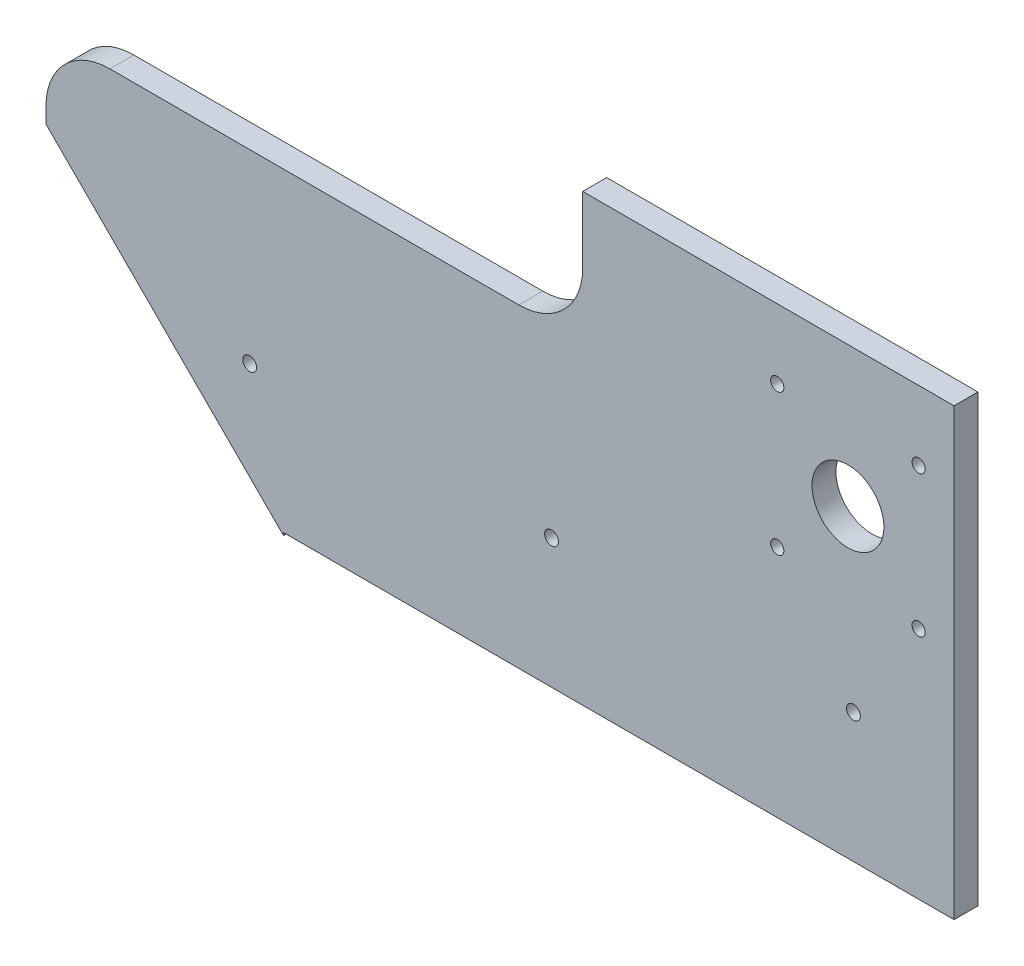
from build123d import *

# Parameters (mm, degrees)
SKETCH1_R                    = 14.2875
BOSS_EXTRUDE1_DEPTH          = 9.525
SKETCH2_W                    = 285.57287806
SKETCH2_H                    = 77.089
CUT_EXTRUDE1_DEPTH           = 267.58430025
SKETCH4_W                    = 213.36
SKETCH4_H                    = 65.465352004
CUT_EXTRUDE2_DEPTH           = 267.58430025
FILLET2_R                    = 25.4
F_5_5_5_5_DIAMETER_HOLE1_D   = 5.5
SKETCH16_W                   = 9.525
SKETCH16_H                   = 0.985363282
CUT_EXTRUDE3_DEPTH           = 390.572219806
SKETCH17_W                   = 147.610011278
SKETCH17_H                   = 12.7
CUT_EXTRUDE4_DEPTH           = 267.045158533
TAP_DRILL_FOR_M6X0_75_TAP1_D = 5.25


with BuildPart() as part:
    # Sketch1 → Boss-Extrude1 (new body)
    with BuildSketch(Plane.XY):
        Polygon((-138.259383474, 48.991487021), (32.210627804, -121.478524257), (222.710627804, -121.478524257), (222.710627804, 146.206839025), (-138.259383474, 146.206839025), align=None)
        with Locations((180.538014078, 76.831975743)):
            Circle(SKETCH1_R, mode=Mode.SUBTRACT)
    extrude(amount=BOSS_EXTRUDE1_DEPTH)

    # Sketch2 → Cut-Extrude1 (cut, through all)
    with BuildSketch(Plane.XY.offset(9.525)):
        with Locations((98.974188774, -82.934024257)):
            Rectangle(SKETCH2_W, SKETCH2_H)
    extrude(amount=-CUT_EXTRUDE1_DEPTH, mode=Mode.SUBTRACT)

    # Sketch4 → Cut-Extrude2 (cut, through all)
    with BuildSketch(Plane.XY.offset(9.525)):
        with Locations((-31.579383474, 113.474163023)):
            Rectangle(SKETCH4_W, SKETCH4_H)
    extrude(amount=-CUT_EXTRUDE2_DEPTH, mode=Mode.SUBTRACT)

    # Fillet2
    fillet2_edges = [part.edges().sort_by_distance(p)[0] for p in [
        (-138.259383474, 80.741487021, 4.7625),
        (75.100616526, 80.741487021, 4.7625),
    ]]
    fillet(fillet2_edges, radius=FILLET2_R)

    # Ø5.5 (5.5) Diameter Hole1 (through all)
    with Locations(Plane(origin=(0, 0, 0), x_dir=(-1, 0, 0), z_dir=(0, 0, -1))):
        with Locations((-182.710627794, 7.042935743), (-62.710627794, 7.042935743), (57.289372206, 7.042935743)):
            Hole(F_5_5_5_5_DIAMETER_HOLE1_D / 2)

    # Sketch16 → Cut-Extrude3 (cut, through all)
    with BuildSketch(Plane(origin=(222.710627804, 0, 0), x_dir=(0, 0, -1), z_dir=(1, 0, 0))):
        with Locations((-4.7625, 145.714157384)):
            Rectangle(SKETCH16_W, SKETCH16_H)
    extrude(amount=-CUT_EXTRUDE3_DEPTH, mode=Mode.SUBTRACT)

    # Sketch17 → Cut-Extrude4 (cut, through all)
    with BuildSketch(Plane(origin=(0, 0, 0), x_dir=(-1, 0, 0), z_dir=(0, 0, -1))):
        with Locations((-148.905622165, 138.871475743)):
            Rectangle(SKETCH17_W, SKETCH17_H)
    extrude(amount=-CUT_EXTRUDE4_DEPTH, mode=Mode.SUBTRACT)

    # Tap Drill for M6x0.75 Tap1 (through all)
    with Locations(Plane.XY.offset(9.525)):
        with Locations((208.638014078, 104.931975743), (152.438014078, 104.931975743), (152.438014078, 48.731975743), (208.638014078, 48.731975743)):
            Hole(TAP_DRILL_FOR_M6X0_75_TAP1_D / 2)


solid = part.part
